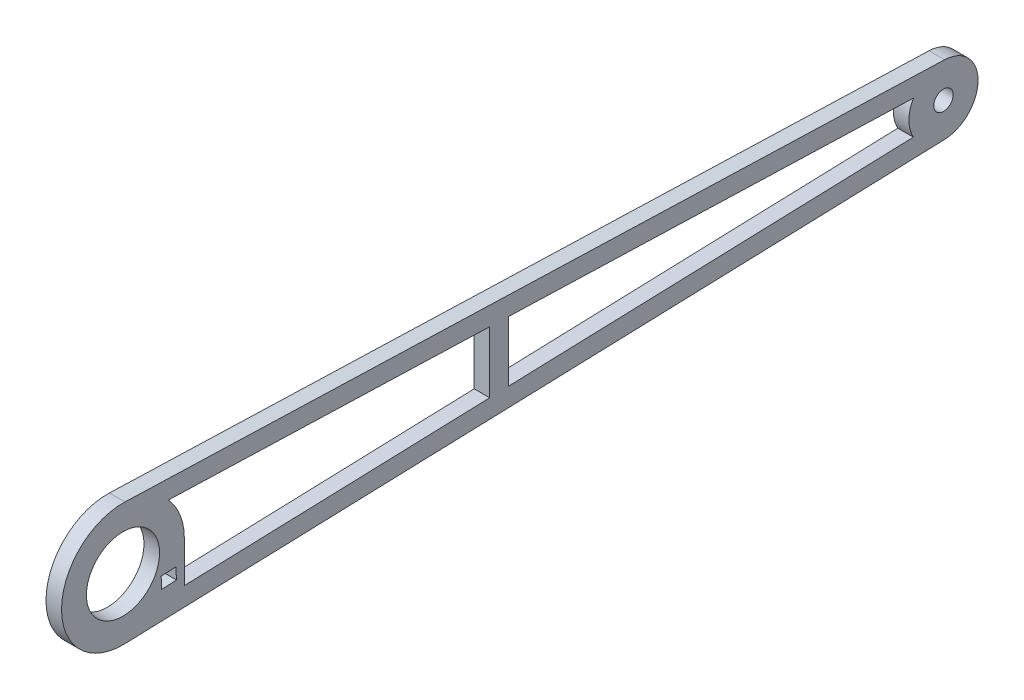
from build123d import *

# Parameters (mm, degrees)
SKETCH1_R           = 0.9906
SKETCH1_R_2         = 3.7338
BOSS_EXTRUDE1_DEPTH = 1.5875


with BuildPart() as part:
    # Sketch1 → Boss-Extrude1 (new body)
    with BuildSketch(Plane(origin=(0, 0, 0), x_dir=(0, 0, -1), z_dir=(1, 0, 0))):
        with BuildLine():
            Line((83.935546909, 3.528708726), (0.205324364, 6.270439247))
            ThreePointArc((0.205324364, 6.270439247), (-6.2738, 2.3e-08), (0.205324317, -6.270439248))
            Line((0.205324317, -6.270439248), (83.935546909, -3.528708726))
            ThreePointArc((83.935546909, -3.528708726), (87.3506, 0), (83.935546909, 3.528708726))
        make_face()
        with BuildLine():
            Line((39.37, 3.081978229), (80.740783809, 1.727299629))
            ThreePointArc((80.740783809, 1.727299629), (80.2894, 0), (80.740783809, -1.727299629))
            Line((80.740783809, -1.727299629), (39.37, -3.081978229))
            Line((39.37, -3.081978229), (39.37, 3.081978229))
        make_face(mode=Mode.SUBTRACT)
        with BuildLine():
            Line((4.643249776, 4.219099188), (37.465, 3.144357099))
            Line((37.465, 3.144357099), (37.465, -3.144357099))
            Line((37.465, -3.144357099), (6.2738, -4.165707125))
            Line((6.2738, -4.165707125), (6.2738, 0))
            ThreePointArc((6.2738, 0), (5.85198201, 2.261608498), (4.643249776, 4.219099188))
        make_face(mode=Mode.SUBTRACT)
        with Locations((83.82, 0)):
            Circle(SKETCH1_R, mode=Mode.SUBTRACT)
        Circle(SKETCH1_R_2, mode=Mode.SUBTRACT)
        Polygon((5.41071769, -2.075285245), (5.466108362, -3.267799527), (3.956436025, -3.33792176), (3.901045354, -2.145407478), align=None, mode=Mode.SUBTRACT)
    extrude(amount=BOSS_EXTRUDE1_DEPTH)


solid = part.part
